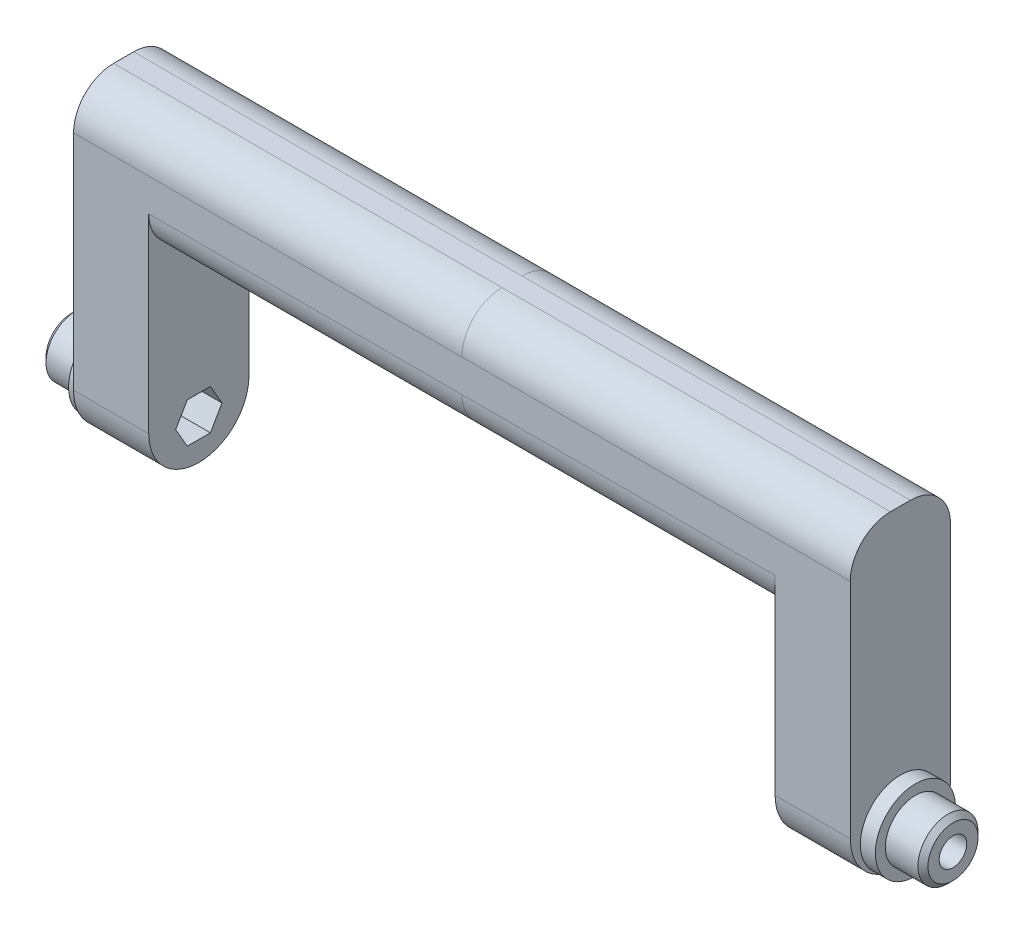
from build123d import *

# Parameters (mm, degrees)
CONNECTOR_MOUNTING_CHAMFER_SIZE              = 1
HANDLE_BODY_DEPTH                            = 10
LOWER_HANDLE_FILLET_R                        = 10
UPPER_HANDLE_FILLET_R                        = 8
MOUNTING_SCREW_HOLE_D                        = 5.5
NUT_CUTOUT_DEPTH                             = 6
LOWER_HANDLE_FILLET_OF_HANDLE_MIRROR_R       = 10
UPPER_HANDLE_FILLET_OF_HANDLE_MIRROR_R       = 8
CONNECTOR_MOUNTING_CHAMFER_OF_CONNECTOR_SIZE = 1


with BuildPart() as part:
    # Sketch1 → connector_body (revolve)
    with BuildSketch(Plane.XY, mode=Mode.PRIVATE) as connector_body_sk:
        Polygon((0, 0), (0, 8), (3, 8), (3, 6), (10.5, 6), (10.5, 0), align=None)
    connector_body = revolve(connector_body_sk.sketch.rotate(Axis((0, 0, 0), (1, 0, 0)), 90), axis=Axis((0, 0, 0), (1, 0, 0)))

    # connector_mounting_chamfer
    connector_mounting_chamfer_edges = [part.edges().sort_by_distance(p)[0] for p in [
        (10.5, 0, -6),
    ]]
    chamfer(connector_mounting_chamfer_edges, length=CONNECTOR_MOUNTING_CHAMFER_SIZE)

    # Sketch2 → handle_body (add, symmetric)
    with BuildSketch(Plane.XY):
        Polygon((0, -8), (0, 54.5), (-77.5, 54.5), (-77.5, 32), (-15, 32), (-15, -8), align=None)
    handle_body = extrude(amount=HANDLE_BODY_DEPTH, both=True)

    # lower_handle_fillet
    # the kernel refuses this fillet: 10 mm, written as the material it takes off along each edge
    with BuildSketch(Plane(origin=(-40, -8, -10), x_dir=(0, 0, 1), z_dir=(1, 0, 0))) as lower_handle_fillet_piece_1:
        with BuildLine():
            CenterArc((LOWER_HANDLE_FILLET_R, -LOWER_HANDLE_FILLET_R), LOWER_HANDLE_FILLET_R, 90, 90)
            Line((0, -LOWER_HANDLE_FILLET_R), (0, 0))
            Line((0, 0), (LOWER_HANDLE_FILLET_R, 0))
        make_face()
    extrude(amount=65, mode=Mode.SUBTRACT)
    with BuildSketch(Plane(origin=(-40, -8, 10), x_dir=(0, 0, -1), z_dir=(1, 0, 0))) as lower_handle_fillet_piece_2:
        with BuildLine():
            CenterArc((LOWER_HANDLE_FILLET_R, LOWER_HANDLE_FILLET_R), LOWER_HANDLE_FILLET_R, 180, 90)
            Line((0, LOWER_HANDLE_FILLET_R), (0, 0))
            Line((0, 0), (LOWER_HANDLE_FILLET_R, 0))
        make_face()
    extrude(amount=65, mode=Mode.SUBTRACT)

    # upper_handle_fillet
    upper_handle_fillet_edges = [part.edges().sort_by_distance(p)[0] for p in [
        (-46.25, 32, -10),
        (-38.75, 54.5, -10),
        (-38.75, 54.5, 10),
        (-46.25, 32, 10),
    ]]
    fillet(upper_handle_fillet_edges, radius=UPPER_HANDLE_FILLET_R)

    # mounting_screw_hole (through all)
    with Locations(Plane(origin=(10.5, 0, 0), x_dir=(0, 0, -1), z_dir=(1, 0, 0))):
        with Locations((0, 0)):
            mounting_screw_hole = Hole(MOUNTING_SCREW_HOLE_D / 2)

    # Sketch6 → nut_cutout (cut)
    with BuildSketch(Plane.ZY.offset(15)):
        Polygon((4.618802154, 0), (2.309401077, 4), (-2.309401077, 4), (-4.618802154, 0), (-2.309401077, -4), (2.309401077, -4), align=None)
    nut_cutout = extrude(amount=-NUT_CUTOUT_DEPTH, mode=Mode.SUBTRACT)

    # handle_mirror: handle_body across plane
    add(handle_body.mirror(Plane(origin=(-77.5, 0, 0), x_dir=(0, 0, 1), z_dir=(1, 0, 0))))

    # lower_handle_fillet of handle_mirror
    # the kernel refuses this fillet: 10 mm, written as the material it takes off along each edge
    with BuildSketch(Plane(origin=(-115, -8, -10), x_dir=(0, 1, 0), z_dir=(-1, 0, 0))) as lower_handle_fillet_of_handle_mirror_piece_1:
        with BuildLine():
            CenterArc((LOWER_HANDLE_FILLET_OF_HANDLE_MIRROR_R, -LOWER_HANDLE_FILLET_OF_HANDLE_MIRROR_R), LOWER_HANDLE_FILLET_OF_HANDLE_MIRROR_R, 90, 90)
            Line((0, -LOWER_HANDLE_FILLET_OF_HANDLE_MIRROR_R), (0, 0))
            Line((0, 0), (LOWER_HANDLE_FILLET_OF_HANDLE_MIRROR_R, 0))
        make_face()
    extrude(amount=65, mode=Mode.SUBTRACT)
    with BuildSketch(Plane(origin=(-115, -8, 10), x_dir=(0, 1, 0), z_dir=(-1, 0, 0))) as lower_handle_fillet_of_handle_mirror_piece_2:
        with BuildLine():
            CenterArc((LOWER_HANDLE_FILLET_OF_HANDLE_MIRROR_R, LOWER_HANDLE_FILLET_OF_HANDLE_MIRROR_R), LOWER_HANDLE_FILLET_OF_HANDLE_MIRROR_R, 180, 90)
            Line((0, LOWER_HANDLE_FILLET_OF_HANDLE_MIRROR_R), (0, 0))
            Line((0, 0), (LOWER_HANDLE_FILLET_OF_HANDLE_MIRROR_R, 0))
        make_face()
    extrude(amount=65, mode=Mode.SUBTRACT)

    # upper_handle_fillet of handle_mirror
    upper_handle_fillet_of_handle_mirror_edges = [part.edges().sort_by_distance(p)[0] for p in [
        (-108.75, 32, -10),
        (-116.25, 54.5, -10),
        (-116.25, 54.5, 10),
        (-108.75, 32, 10),
    ]]
    fillet(upper_handle_fillet_of_handle_mirror_edges, radius=UPPER_HANDLE_FILLET_OF_HANDLE_MIRROR_R)

    # connector_mirror: connector_body, mounting_screw_hole, nut_cutout across plane
    add(connector_body.mirror(Plane(origin=(-77.5, 0, 0), x_dir=(0, 0, 1), z_dir=(1, 0, 0))))
    add(mounting_screw_hole.mirror(Plane(origin=(-77.5, 0, 0), x_dir=(0, 0, 1), z_dir=(1, 0, 0))), mode=Mode.SUBTRACT)
    add(nut_cutout.mirror(Plane(origin=(-77.5, 0, 0), x_dir=(0, 0, 1), z_dir=(1, 0, 0))), mode=Mode.SUBTRACT)

    # connector_mounting_chamfer of connector
    connector_mounting_chamfer_of_connector_edges = [part.edges().sort_by_distance(p)[0] for p in [
        (-165.5, 0, -6),
    ]]
    chamfer(connector_mounting_chamfer_of_connector_edges, length=CONNECTOR_MOUNTING_CHAMFER_OF_CONNECTOR_SIZE)


solid = part.part
